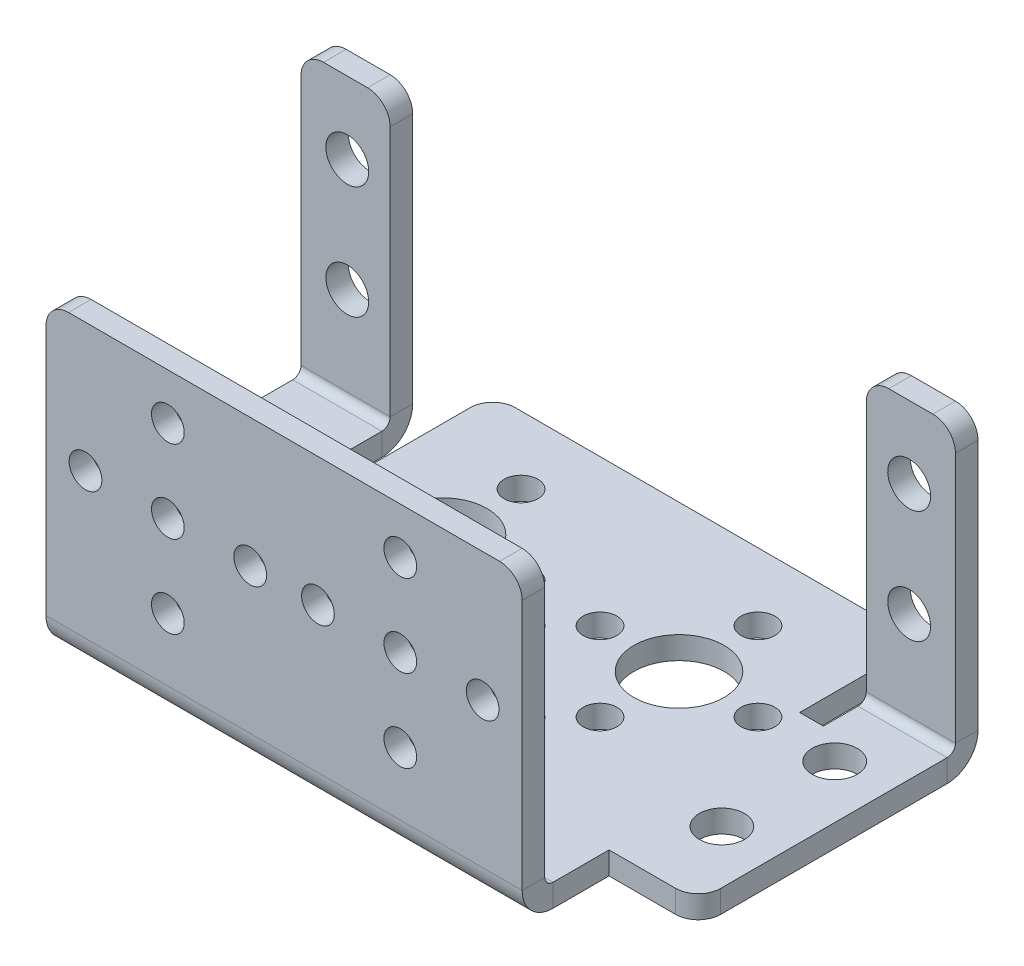
from build123d import *

# Parameters (mm, degrees)
SM_BASE_FLANGE_1_DEPTH             = 2
SM_EDGE_FLANGE_1_STRIP_W           = 9.4732
SM_EDGE_FLANGE_1_STRIP_H           = 2
SM_EDGE_FLANGE_1_STRIP_CUT_DEPTH   = 42.2
SM_EDGE_FLANGE_1_DEPTH             = 42.2
SM_START                           = 2
SM_EDGE_FLANGE_1_FLAT_DEPTH        = 2
SM_EDGE_FLANGE_2_STRIP_W           = 9.4732
SM_EDGE_FLANGE_2_STRIP_H           = 2
SM_EDGE_FLANGE_2_STRIP_CUT_DEPTH   = 7.9
SM_EDGE_FLANGE_2_STRIP_2_W         = 9.4732
SM_EDGE_FLANGE_2_STRIP_2_H         = 2
SM_EDGE_FLANGE_2_STRIP_CUT_2_DEPTH = 7.9
SM_EDGE_FLANGE_2_DEPTH             = 7.9
SM_EDGE_FLANGE_2_PROFILE_R         = 1.9
SM_EDGE_FLANGE_2_FLAT_DEPTH        = 2
SM_EDGE_FLANGE_2_BEND_DEPTH        = 7.9
SM_EDGE_FLANGE_2_PROFILE_2_R       = 1.9
SM_EDGE_FLANGE_2_FLAT_2_DEPTH      = 2
HOLE_WIZARD_8_0_8_1_D              = 8
HOLE_WIZARD_3_0_3_1_D              = 3
HOLE_WIZARD_4_0_4_1_D              = 4
HOLE_WIZARD_2_9_2_9_2_D            = 2.9


# Sheet-metal steps are written as plain solids
with BuildPart() as part:
    # Sketch 2 → 基体-法兰1 (new body)
    with BuildSketch(Plane(origin=(0, 0, 0), x_dir=(1, 0, 0), z_dir=(0, 1, 0))):
        with BuildLine():
            Line((-17, 23.49), (17, 23.49))
            ThreePointArc((17, 23.49), (18.414213562, 22.904213562), (19, 21.49))
            Line((19, 21.49), (19, 12.7))
            Line((19, 12.7), (21.1, 12.7))
            Line((21.1, 12.7), (21.1, 16.5))
            Line((21.1, 16.5), (29, 16.5))
            Line((29, 16.5), (29, -4.3))
            ThreePointArc((29, -4.3), (28.414213562, -5.714213562), (27, -6.3))
            Line((27, -6.3), (21.1, -6.3))
            Line((21.1, -6.3), (21.1, -12))
            Line((21.1, -12), (-21.1, -12))
            Line((-21.1, -12), (-21.1, -6.3))
            Line((-21.1, -6.3), (-27, -6.3))
            ThreePointArc((-27, -6.3), (-28.414213562, -5.714213562), (-29, -4.3))
            Line((-29, -4.3), (-29, 16.5))
            Line((-29, 16.5), (-21.1, 16.5))
            Line((-21.1, 16.5), (-21.1, 12.7))
            Line((-21.1, 12.7), (-19, 12.7))
            Line((-19, 12.7), (-19, 21.49))
            ThreePointArc((-19, 21.49), (-18.414213562, 22.904213562), (-17, 23.49))
        make_face()
    extrude(amount=-SM_BASE_FLANGE_1_DEPTH)

    # 边线-法兰1 strip (across the edge) → 边线-法兰1 strip cut (cut)
    with BuildSketch(Plane(origin=(-21.1, 0, 12), x_dir=(0, 0, -1), z_dir=(1, 0, 0))):
        with Locations((-4, -1)):
            Rectangle(SM_EDGE_FLANGE_1_STRIP_W, SM_EDGE_FLANGE_1_STRIP_H)
    extrude(amount=SM_EDGE_FLANGE_1_STRIP_CUT_DEPTH, mode=Mode.SUBTRACT)

    # 边线-法兰1 bend section (across the edge) → 边线-法兰1 (add)
    with BuildSketch(Plane(origin=(-21.1, 0, 12), x_dir=(0, 0, -1), z_dir=(1, 0, 0))):
        with BuildLine():
            Line((-2, 0.7366), (0, 0.7366))
            ThreePointArc((0, 0.7366), (0.215745145, 0.215745145), (0.7366, 0))
            Line((0.7366, 0), (0.7366, -2))
            ThreePointArc((0.7366, -2), (-1.198468417, -1.198468417), (-2, 0.7366))
        make_face()
    extrude(amount=SM_EDGE_FLANGE_1_DEPTH)

    # 边线-法兰1 profile (on flange) → 边线-法兰1 flat (add)
    with BuildSketch(Plane.XY.offset(12).offset(SM_START)):
        with BuildLine():
            Line((-21.1, 0.7366), (21.1, 0.7366))
            Line((21.1, 0.7366), (21.1, 23))
            ThreePointArc((21.1, 23), (20.514213562, 24.414213562), (19.1, 25))
            Line((19.1, 25), (-19.1, 25))
            ThreePointArc((-19.1, 25), (-20.514213562, 24.414213562), (-21.1, 23))
            Line((-21.1, 23), (-21.1, 0.7366))
        make_face()
    extrude(amount=-SM_EDGE_FLANGE_1_FLAT_DEPTH)

    # 边线-法兰2 strip (across the edge) → 边线-法兰2 strip cut (cut)
    with BuildSketch(Plane(origin=(-21.1, 0, -16.5), x_dir=(0, 0, 1), z_dir=(-1, 0, 0))):
        with Locations((-4, -1)):
            Rectangle(SM_EDGE_FLANGE_2_STRIP_W, SM_EDGE_FLANGE_2_STRIP_H)
    extrude(amount=SM_EDGE_FLANGE_2_STRIP_CUT_DEPTH, mode=Mode.SUBTRACT)

    # 边线-法兰2 strip 2 (across the edge) → 边线-法兰2 strip cut 2 (cut)
    with BuildSketch(Plane(origin=(29, 0, -16.5), x_dir=(0, 0, 1), z_dir=(-1, 0, 0))):
        with Locations((-4, -1)):
            Rectangle(SM_EDGE_FLANGE_2_STRIP_2_W, SM_EDGE_FLANGE_2_STRIP_2_H)
    extrude(amount=SM_EDGE_FLANGE_2_STRIP_CUT_2_DEPTH, mode=Mode.SUBTRACT)

    # 边线-法兰2 bend section (across the edge) → 边线-法兰2 (add)
    with BuildSketch(Plane(origin=(-21.1, 0, -16.5), x_dir=(0, 0, 1), z_dir=(-1, 0, 0))):
        with BuildLine():
            Line((-2, 0.7366), (0, 0.7366))
            ThreePointArc((0, 0.7366), (0.215745145, 0.215745145), (0.7366, 0))
            Line((0.7366, 0), (0.7366, -2))
            ThreePointArc((0.7366, -2), (-1.198468417, -1.198468417), (-2, 0.7366))
        make_face()
    extrude(amount=SM_EDGE_FLANGE_2_DEPTH)

    # 边线-法兰2 profile (on flange) → 边线-法兰2 flat (add)
    with BuildSketch(Plane(origin=(0, 0, -16.5), x_dir=(-1, 0, 0), z_dir=(0, 0, -1)).offset(SM_START)):
        with BuildLine():
            ThreePointArc((23.1, 25), (21.685786438, 24.414213562), (21.1, 23))
            Line((21.1, 23), (21.1, 0.7366))
            Line((21.1, 0.7366), (29, 0.7366))
            Line((29, 0.7366), (29, 23))
            ThreePointArc((29, 23), (28.414213562, 24.414213562), (27, 25))
            Line((27, 25), (23.1, 25))
        make_face()
        with Locations((24.9, 8.6)):
            Circle(SM_EDGE_FLANGE_2_PROFILE_R, mode=Mode.SUBTRACT)
        with Locations((24.9, 18.6)):
            Circle(SM_EDGE_FLANGE_2_PROFILE_R, mode=Mode.SUBTRACT)
    extrude(amount=-SM_EDGE_FLANGE_2_FLAT_DEPTH)

    # 边线-法兰2 bend section 2 (across the edge) → 边线-法兰2 bend (add)
    with BuildSketch(Plane(origin=(29, 0, -16.5), x_dir=(0, 0, 1), z_dir=(-1, 0, 0))):
        with BuildLine():
            Line((-2, 0.7366), (0, 0.7366))
            ThreePointArc((0, 0.7366), (0.215745145, 0.215745145), (0.7366, 0))
            Line((0.7366, 0), (0.7366, -2))
            ThreePointArc((0.7366, -2), (-1.198468417, -1.198468417), (-2, 0.7366))
        make_face()
    extrude(amount=SM_EDGE_FLANGE_2_BEND_DEPTH)

    # 边线-法兰2 profile 2 (on flange) → 边线-法兰2 flat 2 (add)
    with BuildSketch(Plane(origin=(0, 0, -16.5), x_dir=(-1, 0, 0), z_dir=(0, 0, -1)).offset(SM_START)):
        with BuildLine():
            Line((-29, 23), (-29, 0.7366))
            Line((-29, 0.7366), (-21.1, 0.7366))
            Line((-21.1, 0.7366), (-21.1, 23))
            ThreePointArc((-21.1, 23), (-21.685786438, 24.414213562), (-23.1, 25))
            Line((-23.1, 25), (-27, 25))
            ThreePointArc((-27, 25), (-28.414213562, 24.414213562), (-29, 23))
        make_face()
        with Locations((-24.9, 8.6)):
            Circle(SM_EDGE_FLANGE_2_PROFILE_2_R, mode=Mode.SUBTRACT)
        with Locations((-24.9, 18.6)):
            Circle(SM_EDGE_FLANGE_2_PROFILE_2_R, mode=Mode.SUBTRACT)
    extrude(amount=-SM_EDGE_FLANGE_2_FLAT_2_DEPTH)

    # Ø8.0 (8) 直径孔1 (through all)
    with Locations(Plane(origin=(0, 0, 0), x_dir=(1, 0, 0), z_dir=(0, 1, 0))):
        with Locations((0, 0), (-10.5, 10.5), (10.5, 10.5)):
            Hole(HOLE_WIZARD_8_0_8_1_D / 2)

    # Ø3.0 (3) 直径孔1 (through all)
    with Locations(Plane(origin=(0, 0, 0), x_dir=(1, 0, 0), z_dir=(0, 1, 0))):
        with Locations((0, -7), (-17.5, 10.5), (17.5, 10.5), (-3.5, 10.5), (-10.5, 17.5), (-10.5, 3.5), (0, 7), (-7, 0), (7, 0), (10.5, 3.5), (3.5, 10.5), (10.5, 17.5)):
            Hole(HOLE_WIZARD_3_0_3_1_D / 2)

    # Ø4.0 (4) 直径孔1 (through all)
    with Locations(Plane(origin=(0, 0, 0), x_dir=(1, 0, 0), z_dir=(0, 1, 0))):
        with Locations((-24.3, 10.5), (-24.3, 0.5), (24.3, 10.5), (24.3, 0.5)):
            Hole(HOLE_WIZARD_4_0_4_1_D / 2)

    # Ø2.9 (2.9) 直径孔2 (through all)
    with Locations(Plane.XY.offset(14)):
        with Locations((10.3, 13.6), (-10.3, 13.6), (-10.3, 20.9), (-17.6, 13.6), (-10.3, 6.3), (-3, 13.6), (3, 13.6), (10.3, 20.9), (10.3, 6.3), (17.6, 13.6)):
            Hole(HOLE_WIZARD_2_9_2_9_2_D / 2)


solid = part.part
